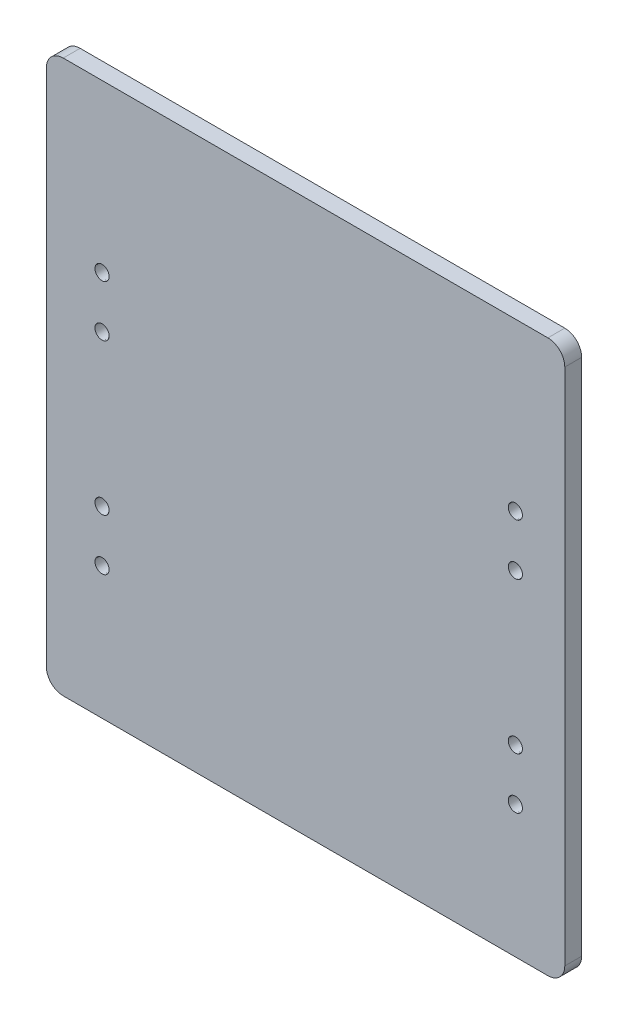
from build123d import *

# Parameters (mm, degrees)
EXTRUDE_1_DEPTH     = 5
CUT_EXTRUDE_START   = -5
CUT_EXTRUDE_1_DEPTH = 5


# Read off the part's stored shape, not the designer's step: 切除-拉伸1
with BuildPart() as part:
    # 草图1 → 凸台-拉伸1 (new body)
    with BuildSketch(Plane(origin=(-1.862e-06, -3.723e-06, -42.591431388), x_dir=(-0.999999999999999, 3.821371455846319e-15, 4.3711395709347256e-08), z_dir=(-4.371139570934742e-08, -8.742277371457049e-08, -0.9999999999999953))):
        with BuildLine():
            Line((41.409226449, 120.237361108), (-102.238542261, 120.237348614))
            ThreePointArc((-102.238542261, 120.237348614), (-105.774157813, 118.772848341), (-107.238657471, 115.237232534))
            Line((-107.238657471, 115.237232534), (-107.238644101, -38.484242555))
            ThreePointArc((-107.238644101, -38.484242555), (-105.774643614, -42.018651515), (-102.2402344, -43.482651386))
            Line((-102.2402344, -43.482651386), (41.410947067, -43.482638892))
            ThreePointArc((41.410947067, -43.482638892), (44.945356028, -42.018638406), (46.409355899, -38.484229191))
            Line((46.409355899, -38.484229191), (46.409342529, 115.237245898))
            ThreePointArc((46.409342529, 115.237245898), (44.944842256, 118.77286145), (41.409226449, 120.237361108))
        make_face()
    extrude(amount=EXTRUDE_1_DEPTH)

    # 切除-拉伸1 outline → 切除-拉伸1 (cut)
    with BuildSketch(Plane(origin=(-1.862e-06, -3.723e-06, -42.591431388), x_dir=(0.999999999999999, -3.82137145584633e-15, -4.371139570934726e-08), z_dir=(4.371139570934743e-08, 8.742277371457055e-08, 0.9999999999999953)).offset(CUT_EXTRUDE_START)):
        with BuildLine():
            add(Edge.make_bspline(
                [(-30.875379785, 57.553786493), (-31.042359895, 57.46714204), (-31.356846814, 57.256324434), (-31.839165273, 56.652592362), (-32.088518151, 55.73725734), (-31.854956828, 54.679614122), (-31.124660201, 53.879722314), (-30.232688432, 53.556610222), (-29.461367436, 53.603380207), (-28.931217158, 53.807020515), (-28.45948678, 54.123246924), (-27.97716832, 54.726978996), (-27.727815442, 55.642314018), (-27.961376765, 56.699957236), (-28.691673393, 57.499849044), (-29.583645161, 57.822961136), (-30.354966158, 57.776191151), (-30.708399676, 57.640430946), (-30.875379785, 57.553786493)],
                knots=[0, 0, 0, 0, 0.0625, 0.125, 0.1875, 0.25, 0.3125, 0.375, 0.4375, 0.5, 0.5625, 0.625, 0.6875, 0.75, 0.8125, 0.875, 0.9375, 1, 1, 1, 1], degree=3))
        make_face()
        with BuildLine():
            add(Edge.make_bspline(
                [(93.559040973, -6.17422579), (93.726021083, -6.087581337), (94.040508002, -5.876763731), (94.522826461, -5.273031659), (94.772179339, -4.357696637), (94.538618016, -3.300053419), (93.808321389, -2.500161611), (92.91634962, -2.177049518), (92.145028624, -2.223819504), (91.614878346, -2.427459812), (91.143147968, -2.743686221), (90.660829508, -3.347418293), (90.411476631, -4.262753315), (90.645037953, -5.320396533), (91.375334581, -6.120288341), (92.267306349, -6.443400433), (93.038627346, -6.396630448), (93.392060864, -6.260870243), (93.559040973, -6.17422579)],
                knots=[0, 0, 0, 0, 0.0625, 0.125, 0.1875, 0.25, 0.3125, 0.375, 0.4375, 0.5, 0.5625, 0.625, 0.6875, 0.75, 0.8125, 0.875, 0.9375, 1, 1, 1, 1], degree=3))
        make_face()
        with BuildLine():
            add(Edge.make_bspline(
                [(-30.875383678, 12.803786493), (-31.042363787, 12.71714204), (-31.356850706, 12.506324434), (-31.839169165, 11.902592362), (-32.088522043, 10.98725734), (-31.85496072, 9.929614122), (-31.124664093, 9.129722314), (-30.232692324, 8.806610222), (-29.461371328, 8.853380207), (-28.93122105, 9.057020515), (-28.459490672, 9.373246924), (-27.977172213, 9.976978996), (-27.727819335, 10.892314018), (-27.961380657, 11.949957236), (-28.691677285, 12.749849044), (-29.583649054, 13.072961136), (-30.35497005, 13.026191151), (-30.708403568, 12.890430946), (-30.875383678, 12.803786493)],
                knots=[0, 0, 0, 0, 0.0625, 0.125, 0.1875, 0.25, 0.3125, 0.375, 0.4375, 0.5, 0.5625, 0.625, 0.6875, 0.75, 0.8125, 0.875, 0.9375, 1, 1, 1, 1], degree=3))
        make_face()
        with BuildLine():
            add(Edge.make_bspline(
                [(-30.875385004, -2.446213507), (-31.042365113, -2.53285796), (-31.356852032, -2.743675566), (-31.839170492, -3.347407638), (-32.088523369, -4.26274266), (-31.854962047, -5.320385878), (-31.124665419, -6.120277686), (-30.232693651, -6.443389778), (-29.461372654, -6.396619793), (-28.931222377, -6.192979485), (-28.459491998, -5.876753076), (-27.977173539, -5.273021004), (-27.727820661, -4.357685982), (-27.961381984, -3.300042764), (-28.691678611, -2.500150956), (-29.58365038, -2.177038864), (-30.354971376, -2.223808849), (-30.708404895, -2.359569054), (-30.875385004, -2.446213507)],
                knots=[0, 0, 0, 0, 0.0625, 0.125, 0.1875, 0.25, 0.3125, 0.375, 0.4375, 0.5, 0.5625, 0.625, 0.6875, 0.75, 0.8125, 0.875, 0.9375, 1, 1, 1, 1], degree=3))
        make_face()
        with BuildLine():
            add(Edge.make_bspline(
                [(93.5590423, 9.07577421), (93.726022409, 9.162418663), (94.040509328, 9.373236269), (94.522827787, 9.976968341), (94.772180665, 10.892303363), (94.538619343, 11.949946581), (93.808322715, 12.749838389), (92.916350946, 13.072950482), (92.14502995, 13.026180496), (91.614879673, 12.822540188), (91.143149294, 12.506313779), (90.660830835, 11.902581707), (90.411477957, 10.987246685), (90.64503928, 9.929603467), (91.375335907, 9.129711659), (92.267307676, 8.806599567), (93.038628672, 8.853369552), (93.392062191, 8.989129757), (93.5590423, 9.07577421)],
                knots=[0, 0, 0, 0, 0.0625, 0.125, 0.1875, 0.25, 0.3125, 0.375, 0.4375, 0.5, 0.5625, 0.625, 0.6875, 0.75, 0.8125, 0.875, 0.9375, 1, 1, 1, 1], degree=3))
        make_face()
        with BuildLine():
            add(Edge.make_bspline(
                [(93.559046192, 53.82577421), (93.726026301, 53.912418663), (94.04051322, 54.123236269), (94.52283168, 54.726968341), (94.772184558, 55.642303363), (94.538623235, 56.699946581), (93.808326607, 57.499838389), (92.916354839, 57.822950482), (92.145033842, 57.776180496), (91.614883565, 57.572540188), (91.143153186, 57.256313779), (90.660834727, 56.652581707), (90.411481849, 55.737246685), (90.645043172, 54.679603467), (91.375339799, 53.879711659), (92.267311568, 53.556599567), (93.038632564, 53.603369552), (93.392066083, 53.739129757), (93.559046192, 53.82577421)],
                knots=[0, 0, 0, 0, 0.0625, 0.125, 0.1875, 0.25, 0.3125, 0.375, 0.4375, 0.5, 0.5625, 0.625, 0.6875, 0.75, 0.8125, 0.875, 0.9375, 1, 1, 1, 1], degree=3))
        make_face()
        with BuildLine():
            add(Edge.make_bspline(
                [(93.559047518, 69.07577421), (93.726027628, 69.162418663), (94.040514547, 69.373236269), (94.522833006, 69.976968341), (94.772185884, 70.892303363), (94.538624561, 71.949946581), (93.808327934, 72.749838389), (92.916356165, 73.072950482), (92.145035169, 73.026180496), (91.614884891, 72.822540188), (91.143154513, 72.506313779), (90.660836053, 71.902581707), (90.411483176, 70.987246685), (90.645044498, 69.929603467), (91.375341126, 69.129711659), (92.267312894, 68.806599567), (93.038633891, 68.853369552), (93.392067409, 68.989129757), (93.559047518, 69.07577421)],
                knots=[0, 0, 0, 0, 0.0625, 0.125, 0.1875, 0.25, 0.3125, 0.375, 0.4375, 0.5, 0.5625, 0.625, 0.6875, 0.75, 0.8125, 0.875, 0.9375, 1, 1, 1, 1], degree=3))
        make_face()
        with BuildLine():
            add(Edge.make_bspline(
                [(-30.875378459, 72.803786493), (-31.042358568, 72.71714204), (-31.356845487, 72.506324434), (-31.839163947, 71.902592362), (-32.088516824, 70.98725734), (-31.854955502, 69.929614122), (-31.124658874, 69.129722314), (-30.232687106, 68.806610222), (-29.461366109, 68.853380207), (-28.931215832, 69.057020515), (-28.459485453, 69.373246924), (-27.977166994, 69.976978996), (-27.727814116, 70.892314018), (-27.961375439, 71.949957236), (-28.691672066, 72.749849044), (-29.583643835, 73.072961136), (-30.354964831, 73.026191151), (-30.70839835, 72.890430946), (-30.875378459, 72.803786493)],
                knots=[0, 0, 0, 0, 0.0625, 0.125, 0.1875, 0.25, 0.3125, 0.375, 0.4375, 0.5, 0.5625, 0.625, 0.6875, 0.75, 0.8125, 0.875, 0.9375, 1, 1, 1, 1], degree=3))
        make_face()
    extrude(amount=CUT_EXTRUDE_1_DEPTH, mode=Mode.SUBTRACT)


solid = part.part
